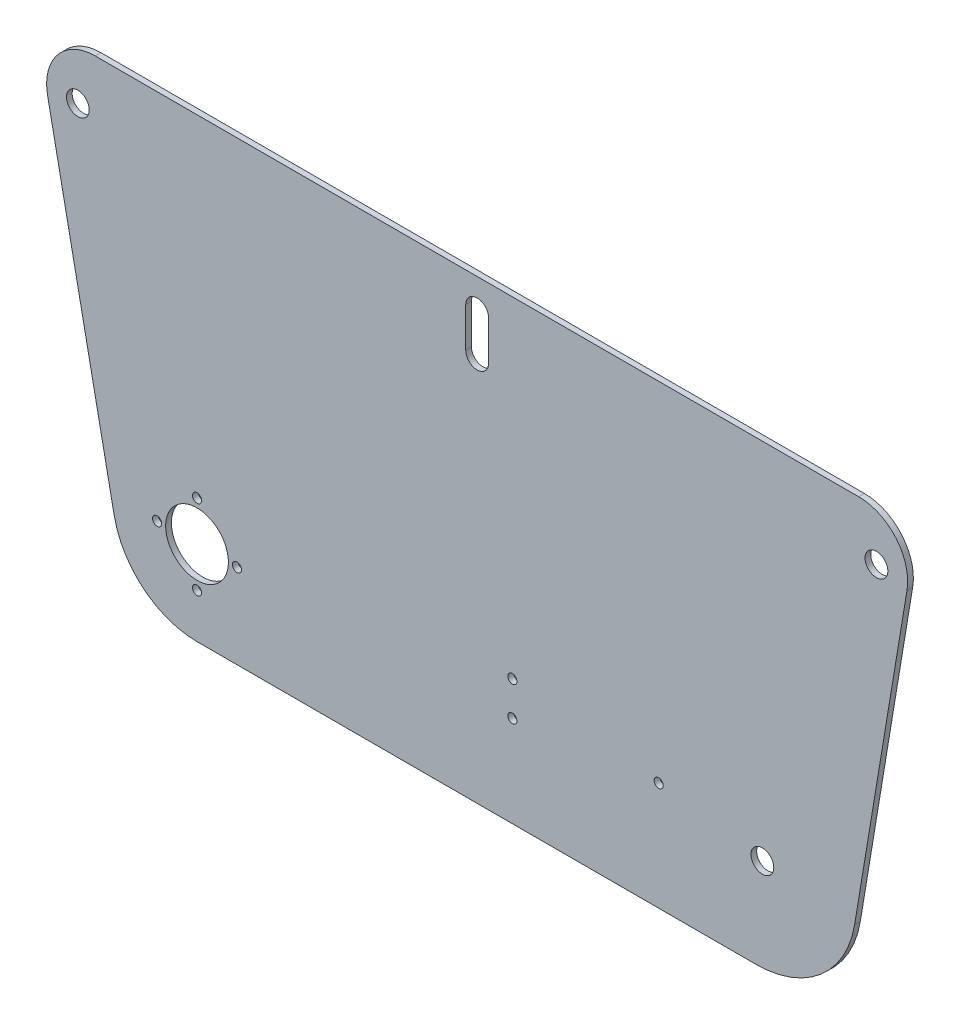
from build123d import *

# Parameters (mm, degrees)
SKETCH3_R           = 1.6
SKETCH3_R_2         = 11
SKETCH3_R_3         = 4
BOSS_EXTRUDE1_DEPTH = 2


with BuildPart() as part:
    # Sketch3 → Boss-Extrude1 (new body)
    with BuildSketch(Plane.XY):
        with BuildLine():
            ThreePointArc((-127.244986336, -3.704660896), (-116.970459317, -20.769936152), (-98.210874228, -27.468256266))
            Line((-98.210874228, -27.468256266), (97.771410342, -27.468256266))
            ThreePointArc((97.771410342, -27.468256266), (120.43275171, -19.155269629), (132.342869895, 1.839758932))
            Line((132.342869895, 1.839758932), (150.718078468, 112.587537538))
            ThreePointArc((150.718078468, 112.587537538), (146.883625567, 126.475757693), (133.810342842, 132.531743734))
            Line((133.810342842, 132.531743734), (-133.934028205, 132.531743734))
            ThreePointArc((-133.934028205, 132.531743734), (-147.098193835, 126.294919118), (-150.609658499, 112.157633172))
            Line((-150.609658499, 112.157633172), (-127.244986336, -3.704660896))
        make_face()
        with Locations((-98.210874228, -11.849671433)):
            Circle(SKETCH3_R, mode=Mode.SUBTRACT)
        with Locations((-112.210874228, 2.150328567)):
            Circle(SKETCH3_R, mode=Mode.SUBTRACT)
        with Locations((-98.210874228, 2.150328567)):
            Circle(SKETCH3_R_2, mode=Mode.SUBTRACT)
        with Locations((-84.210874228, 2.150328567)):
            Circle(SKETCH3_R, mode=Mode.SUBTRACT)
        with Locations((-98.210874228, 16.150328567)):
            Circle(SKETCH3_R, mode=Mode.SUBTRACT)
        with Locations((12.357913989, 4.531743734)):
            Circle(SKETCH3_R, mode=Mode.SUBTRACT)
        with Locations((63.65613527, 10.531743734)):
            Circle(SKETCH3_R, mode=Mode.SUBTRACT)
        with Locations((100, 5.031743734)):
            Circle(SKETCH3_R_3, mode=Mode.SUBTRACT)
        with Locations((12.357913989, 16.531743734)):
            Circle(SKETCH3_R, mode=Mode.SUBTRACT)
        with Locations((-140, 115.061965544)):
            Circle(SKETCH3_R_3, mode=Mode.SUBTRACT)
        with BuildLine():
            Line((-4, 115.061965561), (-4, 121.990168775))
            ThreePointArc((-4, 121.990168775), (0, 125.990168775), (4, 121.990168775))
            Line((4, 121.990168775), (4, 115.061965544))
            Line((4, 115.061965544), (4, 108.133762314))
            ThreePointArc((4, 108.133762314), (0, 104.133762314), (-4, 108.133762314))
            Line((-4, 108.133762314), (-4, 115.061965561))
        make_face(mode=Mode.SUBTRACT)
        with Locations((140, 115.061965544)):
            Circle(SKETCH3_R_3, mode=Mode.SUBTRACT)
    extrude(amount=BOSS_EXTRUDE1_DEPTH)


solid = part.part
